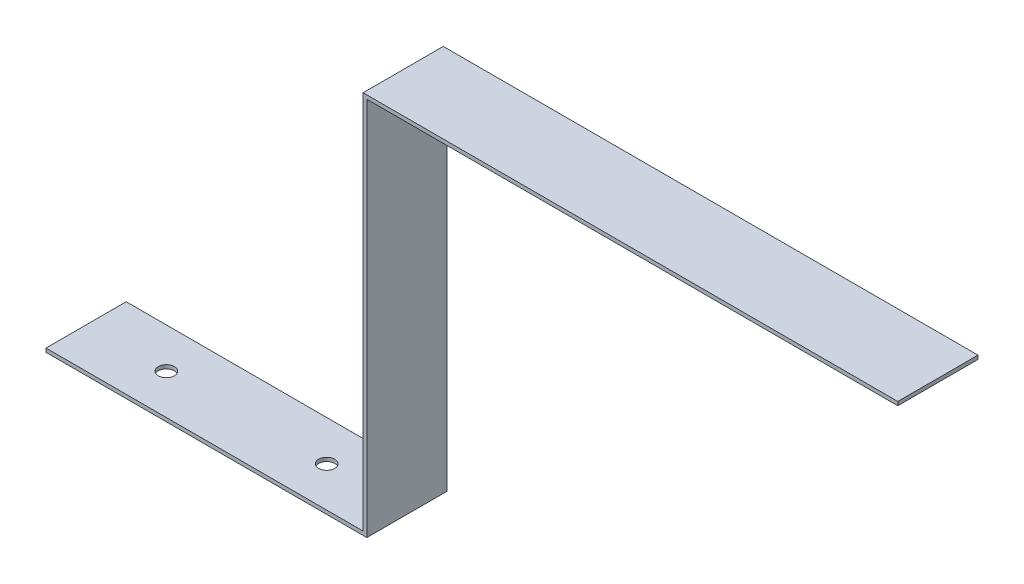
from build123d import *

# Parameters (mm, degrees)
BOSS_EXTRUDE1_DEPTH = 15
SKETCH2_R           = 1.5
CUT_EXTRUDE1_DEPTH  = 176.049964296


with BuildPart() as part:
    # Sketch1 → Boss-Extrude1 (new body)
    with BuildSketch(Plane.XY):
        Polygon((0, 0), (60, 0), (60, 71), (159.3, 71), (159.3, 71.7), (59.3, 71.7), (59.3, 0.7), (0, 0.7), align=None)
    extrude(amount=BOSS_EXTRUDE1_DEPTH)

    # Sketch2 → Cut-Extrude1 (cut, through all)
    with BuildSketch(Plane(origin=(0, 0.7, 0), x_dir=(1, 0, 0), z_dir=(0, 1, 0))):
        with Locations((15, -7.5)):
            Circle(SKETCH2_R)
        with Locations((45, -7.5)):
            Circle(SKETCH2_R)
    extrude(amount=-CUT_EXTRUDE1_DEPTH, mode=Mode.SUBTRACT)


solid = part.part
